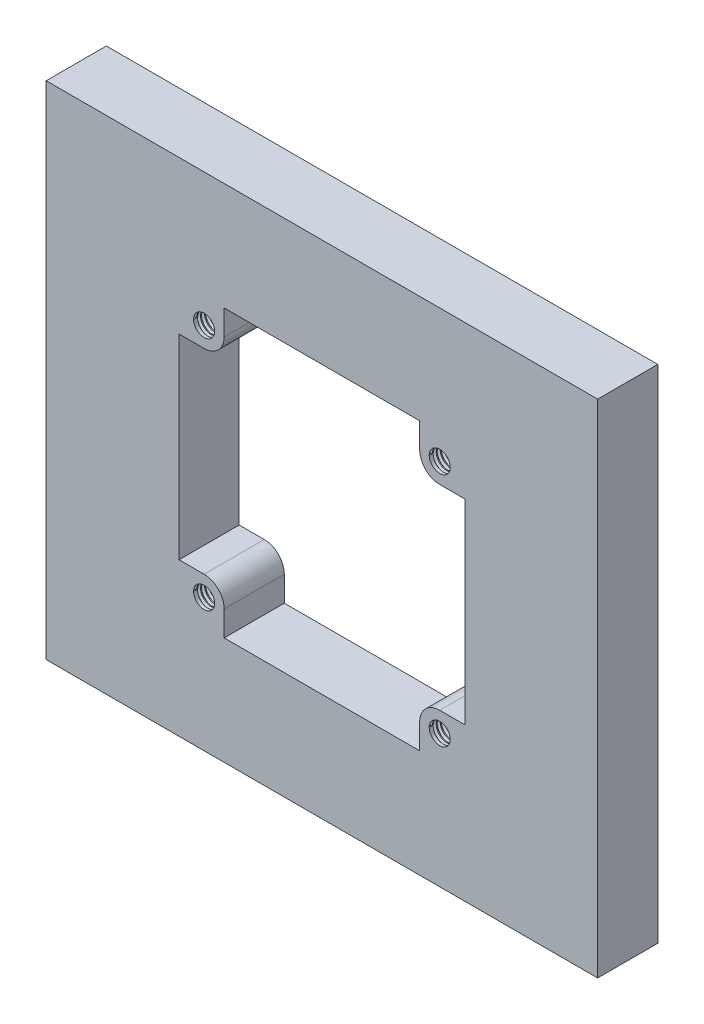
from build123d import *
from build123d.topology import SkipClean

# Parameters (mm, degrees)
SKIZZE1_W                       = 110
SKIZZE1_H                       = 100
AUFSATZ_LINEAR_AUSTRAGEN1_DEPTH = 12
M5_GEWINDEBOHRUNG1_D            = 4.2
M5_GEWINDEBOHRUNG1_DEPTH        = 12.7381927
M5_GEWINDEBOHRUNG1_CSINK_D      = 5.05
M5_GEWINDEBOHRUNG1_CSINK_ANGLE  = 90
M5_GEWINDEBOHRUNG1_TIP          = 1.2618073
SCHNITT_LINEAR_AUSTRAGEN1_DEPTH = 150.1442255
M5_GEWINDEBOHRUNG3_D            = 4.2
GEWINDE2_PITCH                  = 0.8
LINEARES_MUSTER1_COUNT          = 2
LINEARES_MUSTER1_PITCH          = 47
LINEARES_MUSTER1_COUNT_DIR2     = 2
LINEARES_MUSTER1_PITCH_DIR2     = 47


with BuildPart() as part:
    # Skizze1 → Aufsatz-Linear austragen1 (new body)
    with BuildSketch(Plane.XY):
        with Locations((55, 50)):
            Rectangle(SKIZZE1_W, SKIZZE1_H)
    extrude(amount=AUFSATZ_LINEAR_AUSTRAGEN1_DEPTH)

    # M5 Gewindebohrung1
    with Locations(Plane(origin=(0, 0, 0), x_dir=(-1, 0, 0), z_dir=(0, -1, 0))):
        with Locations((-15, -6), (-95, -6)):
            CounterSinkHole(M5_GEWINDEBOHRUNG1_D / 2, M5_GEWINDEBOHRUNG1_CSINK_D / 2, depth=M5_GEWINDEBOHRUNG1_DEPTH, counter_sink_angle=M5_GEWINDEBOHRUNG1_CSINK_ANGLE)
            with Locations((0, 0, -(M5_GEWINDEBOHRUNG1_DEPTH + M5_GEWINDEBOHRUNG1_TIP / 2))):  # 118° drill point
                Cone(0, M5_GEWINDEBOHRUNG1_D / 2, M5_GEWINDEBOHRUNG1_TIP, mode=Mode.SUBTRACT)

    # Skizze8 → Schnitt-Linear austragen1 (cut, through all)
    with BuildSketch(Plane(origin=(0, 0, 0), x_dir=(-1, 0, 0), z_dir=(0, 0, -1))):
        with BuildLine():
            Line((-74.5, 73.5), (-74.5, 78.5))
            Line((-74.5, 78.5), (-35.5, 78.5))
            Line((-35.5, 78.5), (-35.5, 73.5))
            ThreePointArc((-35.5, 73.5), (-34.328427125, 70.671572875), (-31.5, 69.5))
            Line((-31.5, 69.5), (-26.5, 69.5))
            Line((-26.5, 69.5), (-26.5, 30.5))
            Line((-26.5, 30.5), (-31.5, 30.5))
            ThreePointArc((-31.5, 30.5), (-34.328427125, 29.328427125), (-35.5, 26.5))
            Line((-35.5, 26.5), (-35.5, 21.5))
            Line((-35.5, 21.5), (-74.5, 21.5))
            Line((-74.5, 21.5), (-74.5, 26.5))
            ThreePointArc((-74.5, 26.5), (-75.671572875, 29.328427125), (-78.5, 30.5))
            Line((-78.5, 30.5), (-83.5, 30.5))
            Line((-83.5, 30.5), (-83.5, 69.5))
            Line((-83.5, 69.5), (-78.5, 69.5))
            ThreePointArc((-78.5, 69.5), (-75.671572875, 70.671572875), (-74.5, 73.5))
        make_face()
    extrude(amount=-SCHNITT_LINEAR_AUSTRAGEN1_DEPTH, mode=Mode.SUBTRACT)

    # M5 Gewindebohrung3 (through all)
    with Locations(Plane(origin=(0, 0, 0), x_dir=(-1, 0, 0), z_dir=(0, 0, -1))):
        with Locations((-31.5, 26.5), (-78.5, 26.5), (-78.5, 73.5), (-31.5, 73.5)):
            Hole(M5_GEWINDEBOHRUNG3_D / 2)

    # Gewinde2: arcs per turn and ends read off the stored shape
    # Gewinde2: the profile of Gewindeprofil2 profile screwed along a right-hand helix through 15 turns, 8 arcs to a turn; built about Z, then put on its axis
    with SkipClean():  # the faces are left unmerged after this step: merging them gives an invalid solid
        gewinde2_z = Axis((0, 0, 0), (0, 0, 1))
        gewinde2_corners = [(2.0997, 0, -0.000173205), (2.5330127, 0, 0.249999999), (2.5330127, 0, 0.349999999), (2.0997, 0, 0.600173203)]
        with BuildLine(mode=Mode.PRIVATE) as gewinde2_profile:
            Line(gewinde2_corners[0], gewinde2_corners[1])
            Line(gewinde2_corners[1], gewinde2_corners[2])
            Line(gewinde2_corners[2], gewinde2_corners[3])
            Line(gewinde2_corners[3], gewinde2_corners[0])
        gewinde2_cap = Face(gewinde2_profile.wire())
        gewinde2_turn_angles = [0, 22.5, 45, 67.5, 90, 112.5, 135, 157.5, 180, 202.5, 225, 247.5, 270, 292.5, 315, 337.5, 360]
        gewinde2_turn_weights = [1, 0.9238795325112867, 1, 0.9238795325112867, 1, 0.9238795325112867, 1, 0.9238795325112867, 1, 0.9238795325112867, 1, 0.9238795325112867, 1, 0.9238795325112867, 1, 0.9238795325112867, 1]
        gewinde2_turn_rails = [Edge.make_bspline([Vector(p[0], p[1], 0).rotate(gewinde2_z, gewinde2_turn_angles[k]) / gewinde2_turn_weights[k] + Vector(0, 0, p[2] + GEWINDE2_PITCH * gewinde2_turn_angles[k] / 360) for k in range(17)], [0, 0, 0, 1, 1, 2, 2, 3, 3, 4, 4, 5, 5, 6, 6, 7, 7, 8, 8, 8], 2, gewinde2_turn_weights) for p in gewinde2_corners]
        gewinde2_turn_sides = [Face.make_surface_from_curves(gewinde2_turn_rails[p[0]], gewinde2_turn_rails[p[1]]) for p in [(0, 1), (1, 2), (2, 3), (3, 0)]]
        gewinde2 = Plane(origin=(31.5, 26.5, 12), x_dir=(-1, 0, 0), z_dir=(0, 0, -1)) * Solid(Shell([*[p.moved(Location((0, 0, GEWINDE2_PITCH * i))) for i in range(15) for p in gewinde2_turn_sides], gewinde2_cap, gewinde2_cap.rotate(gewinde2_z, 5400).moved(Location((0, 0, GEWINDE2_PITCH * 5400 / 360)))]))
        add(gewinde2, mode=Mode.SUBTRACT)

    # Lineares Muster1: Gewinde2 2 × 2
    with SkipClean():  # the faces are left unmerged after this step: merging them gives an invalid solid
        with Locations(*[(j * LINEARES_MUSTER1_PITCH_DIR2, i * LINEARES_MUSTER1_PITCH, 0) for i in range(LINEARES_MUSTER1_COUNT) for j in range(LINEARES_MUSTER1_COUNT_DIR2) if (i, j) != (0, 0)]):
            add(gewinde2, mode=Mode.SUBTRACT)


solid = part.part
